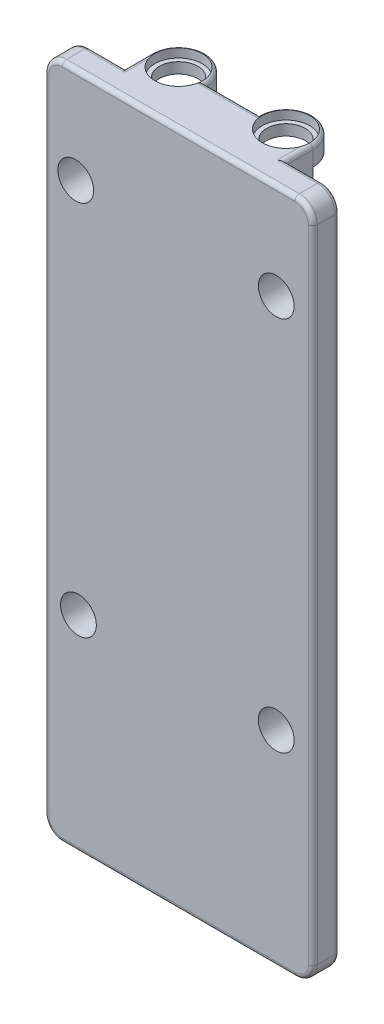
from build123d import *

# Parameters (mm, degrees)
BOSS_EXTRUDE1_OUTLINE_W        = 30
BOSS_EXTRUDE1_OUTLINE_H        = 75.6
BOSS_EXTRUDE1_DEPTH            = 3
BOSS_EXTRUDE1_START            = -0.5
BOSS_EXTRUDE1_2_DEPTH          = 0.5
BOSS_EXTRUDE1_START_2          = -51.669534626
BOSS_EXTRUDE1_3_OUTLINE_W      = 18
BOSS_EXTRUDE1_3_OUTLINE_H      = 2.5
BOSS_EXTRUDE1_3_DEPTH          = 12
BOSS_EXTRUDE1_START_3          = 5.930465374
BOSS_EXTRUDE1_4_OUTLINE_W      = 18
BOSS_EXTRUDE1_4_OUTLINE_H      = 2.5
BOSS_EXTRUDE1_4_DEPTH          = 12
BOSS_EXTRUDE1_START_4          = -54.669534626
BOSS_EXTRUDE1_5_DEPTH          = 18
BOSS_EXTRUDE1_START_5          = 2.930465374
BOSS_EXTRUDE1_6_DEPTH          = 18
BOSS_EXTRUDE1_START_6          = -53.669534626
BOSS_EXTRUDE1_7_OUTLINE_R      = 2
BOSS_EXTRUDE1_7_DEPTH          = 1.2
BOSS_EXTRUDE1_START_7          = -38.869534626
BOSS_EXTRUDE1_8_OUTLINE_R      = 2
BOSS_EXTRUDE1_8_DEPTH          = 1.2
BOSS_EXTRUDE1_START_8          = 3.930465374
BOSS_EXTRUDE1_9_OUTLINE_R      = 2
BOSS_EXTRUDE1_9_DEPTH          = 1.2
BOSS_EXTRUDE1_START_9          = 18.730465374
BOSS_EXTRUDE1_10_OUTLINE_R     = 2
BOSS_EXTRUDE1_10_DEPTH         = 1.2
BOSS_EXTRUDE1_11_DEPTH         = 1
BOSS_EXTRUDE1_START_10         = -37.669534626
BOSS_EXTRUDE1_12_DEPTH         = 1
BOSS_EXTRUDE1_13_DEPTH         = 1
BOSS_EXTRUDE1_START_11         = 19.930465374
BOSS_EXTRUDE1_14_DEPTH         = 1
SKETCH2_R                      = 2
CUT_EXTRUDE1_DEPTH             = 59.811945383
CUT_EXTRUDE2_DEPTH             = 59.428117544
FILLET1_R                      = 2
FILLET2_R                      = 0.5
SKETCH4_R                      = 2.15
CUT_EXTRUDE3_DEPTH             = 81.849261107
SKETCH5_R                      = 2.65
CUT_EXTRUDE4_DEPTH             = 1
SKETCH6_R                      = 2.65
CUT_EXTRUDE5_DEPTH             = 13.6
CUT_EXTRUDE6_REACH             = 67.492
SKETCH7_R                      = 2.65
CUT_EXTRUDE6_DIRECTION_2_REACH = 67.492
SKETCH8_R                      = 2.65
CUT_EXTRUDE7_DEPTH             = 13.6
CUT_EXTRUDE8_START             = -1
SKETCH9_R                      = 2.65
CUT_EXTRUDE8_DEPTH             = 1


with BuildPart() as part:
    # Boss-Extrude1: read off the stored shape, not the designer's step
    # Boss-Extrude1 outline → Boss-Extrude1 (new body)
    with BuildSketch(Plane.XY.offset(21.132055411)):
        with Locations((-4.725285891, -16.869534626)):
            Rectangle(BOSS_EXTRUDE1_OUTLINE_W, BOSS_EXTRUDE1_OUTLINE_H)
    extrude(amount=BOSS_EXTRUDE1_DEPTH)

    # Boss-Extrude1 2 outline → Boss-Extrude1 2 (add)
    with BuildSketch(Plane.XY.offset(21.132055411).offset(BOSS_EXTRUDE1_START)):
        Polygon((-13.725285891, 5.130465374), (-13.725285891, 2.930465374), (4.274714109, 2.930465374), (4.274714109, 5.130465374), (4.274714109, 18.730465374), (4.274714109, 20.930465374), (-13.725285891, 20.930465374), (-13.725285891, 18.730465374), align=None)
        Polygon((-13.725285891, -52.469534626), (-13.725285891, -54.669534626), (4.274714109, -54.669534626), (4.274714109, -52.469534626), (4.274714109, -38.869534626), (4.274714109, -36.669534626), (-13.725285891, -36.669534626), (-13.725285891, -38.869534626), align=None)
    extrude(amount=BOSS_EXTRUDE1_2_DEPTH)

    # Boss-Extrude1 3 outline → Boss-Extrude1 3 (add)
    with BuildSketch(Plane(origin=(0, 0, 0), x_dir=(1, 0, 0), z_dir=(0, 1, 0)).offset(BOSS_EXTRUDE1_START_2)):
        with Locations((-4.725285891, -19.382055411)):
            Rectangle(BOSS_EXTRUDE1_3_OUTLINE_W, BOSS_EXTRUDE1_3_OUTLINE_H)
    extrude(amount=BOSS_EXTRUDE1_3_DEPTH)

    # Boss-Extrude1 4 outline → Boss-Extrude1 4 (add)
    with BuildSketch(Plane(origin=(0, 0, 0), x_dir=(1, 0, 0), z_dir=(0, 1, 0)).offset(BOSS_EXTRUDE1_START_3)):
        with Locations((-4.725285891, -19.382055411)):
            Rectangle(BOSS_EXTRUDE1_4_OUTLINE_W, BOSS_EXTRUDE1_4_OUTLINE_H)
    extrude(amount=BOSS_EXTRUDE1_4_DEPTH)

    # Boss-Extrude1 5 outline → Boss-Extrude1 5 (add)
    with BuildSketch(Plane(origin=(0, 0, 0), x_dir=(1, 0, 0), z_dir=(0, 1, 0)).offset(BOSS_EXTRUDE1_START_4)):
        with BuildLine():
            Line((-1.225285891, -18.132055411), (-8.225285891, -18.132055411))
            ThreePointArc((-8.225285891, -18.132055411), (-8.957518938, -19.899822364), (-10.725285891, -20.632055411))
            Line((-10.725285891, -20.632055411), (1.274714109, -20.632055411))
            ThreePointArc((1.274714109, -20.632055411), (-0.493052844, -19.899822364), (-1.225285891, -18.132055411))
        make_face()
        with BuildLine():
            ThreePointArc((-10.725285891, -20.632055411), (-12.493052844, -19.899822364), (-13.225285891, -18.132055411))
            Line((-13.225285891, -18.132055411), (-13.725285891, -18.132055411))
            Line((-13.725285891, -18.132055411), (-13.725285891, -20.632055411))
            Line((-13.725285891, -20.632055411), (-10.725285891, -20.632055411))
        make_face()
        with BuildLine():
            ThreePointArc((3.774714109, -18.132055411), (3.042481062, -19.899822364), (1.274714109, -20.632055411))
            Line((1.274714109, -20.632055411), (4.274714109, -20.632055411))
            Line((4.274714109, -20.632055411), (4.274714109, -18.132055411))
            Line((4.274714109, -18.132055411), (3.774714109, -18.132055411))
        make_face()
    extrude(amount=BOSS_EXTRUDE1_5_DEPTH)

    # Boss-Extrude1 6 outline → Boss-Extrude1 6 (add)
    with BuildSketch(Plane(origin=(0, 0, 0), x_dir=(1, 0, 0), z_dir=(0, 1, 0)).offset(BOSS_EXTRUDE1_START_5)):
        with BuildLine():
            Line((-1.225285891, -18.132055411), (-8.225285891, -18.132055411))
            ThreePointArc((-8.225285891, -18.132055411), (-8.957518938, -19.899822364), (-10.725285891, -20.632055411))
            Line((-10.725285891, -20.632055411), (1.274714109, -20.632055411))
            ThreePointArc((1.274714109, -20.632055411), (-0.493052844, -19.899822364), (-1.225285891, -18.132055411))
        make_face()
        with BuildLine():
            ThreePointArc((-10.725285891, -20.632055411), (-12.493052844, -19.899822364), (-13.225285891, -18.132055411))
            Line((-13.225285891, -18.132055411), (-13.725285891, -18.132055411))
            Line((-13.725285891, -18.132055411), (-13.725285891, -20.632055411))
            Line((-13.725285891, -20.632055411), (-10.725285891, -20.632055411))
        make_face()
        with BuildLine():
            ThreePointArc((3.774714109, -18.132055411), (3.042481062, -19.899822364), (1.274714109, -20.632055411))
            Line((1.274714109, -20.632055411), (4.274714109, -20.632055411))
            Line((4.274714109, -20.632055411), (4.274714109, -18.132055411))
            Line((4.274714109, -18.132055411), (3.774714109, -18.132055411))
        make_face()
    extrude(amount=BOSS_EXTRUDE1_6_DEPTH)

    # Boss-Extrude1 7 outline → Boss-Extrude1 7 (add)
    # profile 1 of 2: a face of its own
    with BuildSketch(Plane(origin=(0, 0, 0), x_dir=(1, 0, 0), z_dir=(0, 1, 0)).offset(BOSS_EXTRUDE1_START_6)):
        with BuildLine():
            Line((-8.225285891, -18.132055411), (-7.725285891, -18.132055411))
            ThreePointArc((-7.725285891, -18.132055411), (-10.725285891, -15.132055411), (-13.725285891, -18.132055411))
            Line((-13.725285891, -18.132055411), (-13.225285891, -18.132055411))
            ThreePointArc((-13.225285891, -18.132055411), (-10.725285891, -20.632055411), (-8.225285891, -18.132055411))
        make_face()
        with Locations((-10.725285891, -18.132055411)):
            Circle(BOSS_EXTRUDE1_7_OUTLINE_R, mode=Mode.SUBTRACT)
    # profile 2 of 2: a face of its own
    with BuildSketch(Plane(origin=(0, 0, 0), x_dir=(1, 0, 0), z_dir=(0, 1, 0)).offset(BOSS_EXTRUDE1_START_6)):
        with BuildLine():
            ThreePointArc((-1.225285891, -18.132055411), (1.274714109, -20.632055411), (3.774714109, -18.132055411))
            Line((3.774714109, -18.132055411), (4.274714109, -18.132055411))
            ThreePointArc((4.274714109, -18.132055411), (1.274714109, -15.132055411), (-1.725285891, -18.132055411))
            Line((-1.725285891, -18.132055411), (-1.225285891, -18.132055411))
        make_face()
        with Locations((1.274714109, -18.132055411)):
            Circle(BOSS_EXTRUDE1_7_OUTLINE_R, mode=Mode.SUBTRACT)
    extrude(amount=BOSS_EXTRUDE1_7_DEPTH)

    # Boss-Extrude1 8 outline → Boss-Extrude1 8 (add)
    # profile 1 of 2: a face of its own
    with BuildSketch(Plane(origin=(0, 0, 0), x_dir=(1, 0, 0), z_dir=(0, 1, 0)).offset(BOSS_EXTRUDE1_START_7)):
        with BuildLine():
            Line((-8.225285891, -18.132055411), (-7.725285891, -18.132055411))
            ThreePointArc((-7.725285891, -18.132055411), (-10.725285891, -15.132055411), (-13.725285891, -18.132055411))
            Line((-13.725285891, -18.132055411), (-13.225285891, -18.132055411))
            ThreePointArc((-13.225285891, -18.132055411), (-10.725285891, -20.632055411), (-8.225285891, -18.132055411))
        make_face()
        with Locations((-10.725285891, -18.132055411)):
            Circle(BOSS_EXTRUDE1_8_OUTLINE_R, mode=Mode.SUBTRACT)
    # profile 2 of 2: a face of its own
    with BuildSketch(Plane(origin=(0, 0, 0), x_dir=(1, 0, 0), z_dir=(0, 1, 0)).offset(BOSS_EXTRUDE1_START_7)):
        with BuildLine():
            ThreePointArc((-1.225285891, -18.132055411), (1.274714109, -20.632055411), (3.774714109, -18.132055411))
            Line((3.774714109, -18.132055411), (4.274714109, -18.132055411))
            ThreePointArc((4.274714109, -18.132055411), (1.274714109, -15.132055411), (-1.725285891, -18.132055411))
            Line((-1.725285891, -18.132055411), (-1.225285891, -18.132055411))
        make_face()
        with Locations((1.274714109, -18.132055411)):
            Circle(BOSS_EXTRUDE1_8_OUTLINE_R, mode=Mode.SUBTRACT)
    extrude(amount=BOSS_EXTRUDE1_8_DEPTH)

    # Boss-Extrude1 9 outline → Boss-Extrude1 9 (add)
    # profile 1 of 2: a face of its own
    with BuildSketch(Plane(origin=(0, 0, 0), x_dir=(1, 0, 0), z_dir=(0, 1, 0)).offset(BOSS_EXTRUDE1_START_8)):
        with BuildLine():
            Line((-8.225285891, -18.132055411), (-7.725285891, -18.132055411))
            ThreePointArc((-7.725285891, -18.132055411), (-10.725285891, -15.132055411), (-13.725285891, -18.132055411))
            Line((-13.725285891, -18.132055411), (-13.225285891, -18.132055411))
            ThreePointArc((-13.225285891, -18.132055411), (-10.725285891, -20.632055411), (-8.225285891, -18.132055411))
        make_face()
        with Locations((-10.725285891, -18.132055411)):
            Circle(BOSS_EXTRUDE1_9_OUTLINE_R, mode=Mode.SUBTRACT)
    # profile 2 of 2: a face of its own
    with BuildSketch(Plane(origin=(0, 0, 0), x_dir=(1, 0, 0), z_dir=(0, 1, 0)).offset(BOSS_EXTRUDE1_START_8)):
        with BuildLine():
            ThreePointArc((-1.225285891, -18.132055411), (1.274714109, -20.632055411), (3.774714109, -18.132055411))
            Line((3.774714109, -18.132055411), (4.274714109, -18.132055411))
            ThreePointArc((4.274714109, -18.132055411), (1.274714109, -15.132055411), (-1.725285891, -18.132055411))
            Line((-1.725285891, -18.132055411), (-1.225285891, -18.132055411))
        make_face()
        with Locations((1.274714109, -18.132055411)):
            Circle(BOSS_EXTRUDE1_9_OUTLINE_R, mode=Mode.SUBTRACT)
    extrude(amount=BOSS_EXTRUDE1_9_DEPTH)

    # Boss-Extrude1 10 outline → Boss-Extrude1 10 (add)
    # profile 1 of 2: a face of its own
    with BuildSketch(Plane(origin=(0, 0, 0), x_dir=(1, 0, 0), z_dir=(0, 1, 0)).offset(BOSS_EXTRUDE1_START_9)):
        with BuildLine():
            Line((-8.225285891, -18.132055411), (-7.725285891, -18.132055411))
            ThreePointArc((-7.725285891, -18.132055411), (-10.725285891, -15.132055411), (-13.725285891, -18.132055411))
            Line((-13.725285891, -18.132055411), (-13.225285891, -18.132055411))
            ThreePointArc((-13.225285891, -18.132055411), (-10.725285891, -20.632055411), (-8.225285891, -18.132055411))
        make_face()
        with Locations((-10.725285891, -18.132055411)):
            Circle(BOSS_EXTRUDE1_10_OUTLINE_R, mode=Mode.SUBTRACT)
    # profile 2 of 2: a face of its own
    with BuildSketch(Plane(origin=(0, 0, 0), x_dir=(1, 0, 0), z_dir=(0, 1, 0)).offset(BOSS_EXTRUDE1_START_9)):
        with BuildLine():
            ThreePointArc((-1.225285891, -18.132055411), (1.274714109, -20.632055411), (3.774714109, -18.132055411))
            Line((3.774714109, -18.132055411), (4.274714109, -18.132055411))
            ThreePointArc((4.274714109, -18.132055411), (1.274714109, -15.132055411), (-1.725285891, -18.132055411))
            Line((-1.725285891, -18.132055411), (-1.225285891, -18.132055411))
        make_face()
        with Locations((1.274714109, -18.132055411)):
            Circle(BOSS_EXTRUDE1_10_OUTLINE_R, mode=Mode.SUBTRACT)
    extrude(amount=BOSS_EXTRUDE1_10_DEPTH)

    # Boss-Extrude1 11 outline → Boss-Extrude1 11 (add)
    with BuildSketch(Plane(origin=(0, 0, 0), x_dir=(1, 0, 0), z_dir=(0, 1, 0)).offset(BOSS_EXTRUDE1_START_4)):
        with BuildLine():
            ThreePointArc((-13.225285891, -18.132055411), (-10.725285891, -15.632055411), (-8.225285891, -18.132055411))
            Line((-8.225285891, -18.132055411), (-7.725285891, -18.132055411))
            ThreePointArc((-7.725285891, -18.132055411), (-10.725285891, -15.132055411), (-13.725285891, -18.132055411))
            Line((-13.725285891, -18.132055411), (-13.225285891, -18.132055411))
        make_face()
        with BuildLine():
            ThreePointArc((4.274714109, -18.132055411), (1.274714109, -15.132055411), (-1.725285891, -18.132055411))
            Line((-1.725285891, -18.132055411), (-1.225285891, -18.132055411))
            ThreePointArc((-1.225285891, -18.132055411), (1.274714109, -15.632055411), (3.774714109, -18.132055411))
            Line((3.774714109, -18.132055411), (4.274714109, -18.132055411))
        make_face()
    extrude(amount=BOSS_EXTRUDE1_11_DEPTH)

    # Boss-Extrude1 12 outline → Boss-Extrude1 12 (add)
    with BuildSketch(Plane(origin=(0, 0, 0), x_dir=(1, 0, 0), z_dir=(0, 1, 0)).offset(BOSS_EXTRUDE1_START_10)):
        with BuildLine():
            ThreePointArc((-13.225285891, -18.132055411), (-10.725285891, -15.632055411), (-8.225285891, -18.132055411))
            Line((-8.225285891, -18.132055411), (-7.725285891, -18.132055411))
            ThreePointArc((-7.725285891, -18.132055411), (-10.725285891, -15.132055411), (-13.725285891, -18.132055411))
            Line((-13.725285891, -18.132055411), (-13.225285891, -18.132055411))
        make_face()
        with BuildLine():
            ThreePointArc((4.274714109, -18.132055411), (1.274714109, -15.132055411), (-1.725285891, -18.132055411))
            Line((-1.725285891, -18.132055411), (-1.225285891, -18.132055411))
            ThreePointArc((-1.225285891, -18.132055411), (1.274714109, -15.632055411), (3.774714109, -18.132055411))
            Line((3.774714109, -18.132055411), (4.274714109, -18.132055411))
        make_face()
    extrude(amount=BOSS_EXTRUDE1_12_DEPTH)

    # Boss-Extrude1 13 outline → Boss-Extrude1 13 (add)
    with BuildSketch(Plane(origin=(0, 0, 0), x_dir=(1, 0, 0), z_dir=(0, 1, 0)).offset(BOSS_EXTRUDE1_START_5)):
        with BuildLine():
            ThreePointArc((-13.225285891, -18.132055411), (-10.725285891, -15.632055411), (-8.225285891, -18.132055411))
            Line((-8.225285891, -18.132055411), (-7.725285891, -18.132055411))
            ThreePointArc((-7.725285891, -18.132055411), (-10.725285891, -15.132055411), (-13.725285891, -18.132055411))
            Line((-13.725285891, -18.132055411), (-13.225285891, -18.132055411))
        make_face()
        with BuildLine():
            ThreePointArc((4.274714109, -18.132055411), (1.274714109, -15.132055411), (-1.725285891, -18.132055411))
            Line((-1.725285891, -18.132055411), (-1.225285891, -18.132055411))
            ThreePointArc((-1.225285891, -18.132055411), (1.274714109, -15.632055411), (3.774714109, -18.132055411))
            Line((3.774714109, -18.132055411), (4.274714109, -18.132055411))
        make_face()
    extrude(amount=BOSS_EXTRUDE1_13_DEPTH)

    # Boss-Extrude1 14 outline → Boss-Extrude1 14 (add)
    with BuildSketch(Plane(origin=(0, 0, 0), x_dir=(1, 0, 0), z_dir=(0, 1, 0)).offset(BOSS_EXTRUDE1_START_11)):
        with BuildLine():
            ThreePointArc((-13.225285891, -18.132055411), (-10.725285891, -15.632055411), (-8.225285891, -18.132055411))
            Line((-8.225285891, -18.132055411), (-7.725285891, -18.132055411))
            ThreePointArc((-7.725285891, -18.132055411), (-10.725285891, -15.132055411), (-13.725285891, -18.132055411))
            Line((-13.725285891, -18.132055411), (-13.225285891, -18.132055411))
        make_face()
        with BuildLine():
            ThreePointArc((4.274714109, -18.132055411), (1.274714109, -15.132055411), (-1.725285891, -18.132055411))
            Line((-1.725285891, -18.132055411), (-1.225285891, -18.132055411))
            ThreePointArc((-1.225285891, -18.132055411), (1.274714109, -15.632055411), (3.774714109, -18.132055411))
            Line((3.774714109, -18.132055411), (4.274714109, -18.132055411))
        make_face()
    extrude(amount=BOSS_EXTRUDE1_14_DEPTH)

    # Sketch2 → Cut-Extrude1 (cut, through all)
    with BuildSketch(Plane.XY.offset(24.132055411)):
        with Locations((-16.212785891, 10.230465374)):
            Circle(SKETCH2_R)
        with Locations((6.187214109, 10.230465374)):
            Circle(SKETCH2_R)
        with Locations((6.187214109, -31.769534626)):
            Circle(SKETCH2_R)
        with Locations((-15.912785891, -31.669534626)):
            Circle(SKETCH2_R)
    extrude(amount=-CUT_EXTRUDE1_DEPTH, mode=Mode.SUBTRACT)

    # Sketch3 → Cut-Extrude2 (cut, through all)
    with BuildSketch(Plane(origin=(0, 0, 21.132055411), x_dir=(-1, 0, 0), z_dir=(0, 0, -1))):
        Polygon((-6.13477618, 13.694170076), (-9.160651408, 12.007730303), (-9.213089336, 8.544025601), (-6.239652037, 6.766760672), (-3.21377681, 8.453200444), (-3.161338881, 11.916905147), align=None)
        Polygon((16.26522382, 13.694170076), (13.239348592, 12.007730303), (13.186910664, 8.544025601), (16.160347963, 6.766760672), (19.18622319, 8.453200444), (19.238661119, 11.916905147), align=None)
    extrude(amount=CUT_EXTRUDE2_DEPTH, mode=Mode.SUBTRACT)

    # Fillet1
    fillet1_edges = [part.edges().sort_by_distance(p)[0] for p in [
        (10.274714109, 20.930465374, 22.632055411),
        (-19.725285891, 20.930465374, 22.632055411),
        (10.274714109, -54.669534626, 22.632055411),
        (-19.725285891, -54.669534626, 22.632055411),
    ]]
    fillet(fillet1_edges, radius=FILLET1_R)

    # Fillet2
    fillet2_edges = [part.edges().sort_by_distance(p)[0] for p in [
        (4.274714109, 20.930465374, 19.632055411),
        (-10.725285891, 20.930465374, 15.132055411),
        (-13.725285891, -54.669534626, 19.632055411),
        (1.274714109, -54.669534626, 15.132055411),
        (-19.139499453, -54.083748188, 24.132055411),
        (-19.725285891, -16.869534626, 24.132055411),
        (-19.139499453, 20.344678936, 24.132055411),
        (-4.725285891, 20.930465374, 24.132055411),
        (9.688927671, 20.344678936, 24.132055411),
        (10.274714109, -16.869534626, 24.132055411),
        (9.688927671, -54.083748188, 24.132055411),
        (6.274714109, -54.669534626, 21.132055411),
        (9.688927671, -54.083748188, 21.132055411),
        (6.274714109, 20.930465374, 21.132055411),
        (9.688927671, 20.344678936, 21.132055411),
        (-15.725285891, 20.930465374, 21.132055411),
        (-19.139499453, 20.344678936, 21.132055411),
        (-15.725285891, -54.669534626, 21.132055411),
        (-19.139499453, -54.083748188, 21.132055411),
        (1.274714109, 20.930465374, 15.132055411),
        (-4.725285891, 20.930465374, 18.132055411),
        (-13.725285891, 20.930465374, 19.632055411),
        (-10.725285891, -54.669534626, 15.132055411),
        (-4.725285891, -54.669534626, 18.132055411),
        (4.274714109, -54.669534626, 19.632055411),
        (-4.725285891, -54.669534626, 24.132055411),
        (10.274714109, -16.869534626, 21.132055411),
        (-19.725285891, -16.869534626, 21.132055411),
        (4.274714109, -36.669534626, 19.632055411),
        (-10.725285891, -36.669534626, 15.132055411),
        (4.274714109, 2.930465374, 19.632055411),
        (-13.725285891, 2.930465374, 19.632055411),
        (1.274714109, -36.669534626, 15.132055411),
        (-4.725285891, -36.669534626, 18.132055411),
        (-13.725285891, -36.669534626, 19.632055411),
        (-4.725285891, 2.930465374, 18.132055411),
        (1.274714109, 2.930465374, 15.132055411),
        (-10.725285891, 2.930465374, 15.132055411),
    ]]
    fillet(fillet2_edges, radius=FILLET2_R - 0.0001)  # a hair under: the kernel refuses the full size

    # Sketch4 → Cut-Extrude3 (cut, through all)
    with BuildSketch(Plane.XZ.offset(53.669534626)):
        with Locations(Location((-10.725285891, 18.132055411, 0), (0, 0, 270))):
            Circle(SKETCH4_R)
        with Locations(Location((1.274714109, 18.132055411, 0), (0, 0, 270))):
            Circle(SKETCH4_R)
    extrude(amount=-CUT_EXTRUDE3_DEPTH, mode=Mode.SUBTRACT)

    # Sketch5 → Cut-Extrude4 (cut)
    with BuildSketch(Plane.XZ.offset(54.669534626)):
        with Locations(Location((-10.725285891, 18.132055411, 0), (0, 0, 180))):
            Circle(SKETCH5_R)
        with Locations((1.274714109, 18.132055411)):
            Circle(SKETCH5_R)
    extrude(amount=-CUT_EXTRUDE4_DEPTH, mode=Mode.SUBTRACT)

    # Sketch6 → Cut-Extrude5 (cut)
    with BuildSketch(Plane(origin=(0, -52.469534626, 0), x_dir=(1, 0, 0), z_dir=(0, 1, 0))):
        with Locations(Location((-10.725285891, -18.132055411, 0), (0, 0, 180))):
            Circle(SKETCH6_R)
        with Locations((1.274714109, -18.132055411)):
            Circle(SKETCH6_R)
    extrude(amount=CUT_EXTRUDE5_DEPTH, mode=Mode.SUBTRACT)

    # Cut-Extrude6: up to this face of the body (flat: up to its plane)
    cut_extrude6_end = Plane(part.part.faces().sort_by_distance((-9.007518938, -37.669534626, 19.849822364))[0])
    # Sketch7 → Cut-Extrude6 (cut, up to the picked face)
    with BuildSketch(Plane(origin=(0, -36.669534626, 0), x_dir=(1, 0, 0), z_dir=(0, 1, 0)), mode=Mode.PRIVATE) as cut_extrude6_sk1:
        with Locations(Location((-10.725285891, -18.132055411, 0), (0, 0, 180))):
            Circle(SKETCH7_R)
    cut_extrude6_tool1 = split(extrude(cut_extrude6_sk1.sketch, amount=-CUT_EXTRUDE6_REACH, mode=Mode.PRIVATE), bisect_by=cut_extrude6_end, keep=Keep.BOTH, mode=Mode.PRIVATE)
    # Sketch7 → Cut-Extrude6 (cut, up to the picked face)
    with BuildSketch(Plane(origin=(0, -36.669534626, 0), x_dir=(1, 0, 0), z_dir=(0, 1, 0)), mode=Mode.PRIVATE) as cut_extrude6_sk2:
        with Locations((1.274714109, -18.132055411)):
            Circle(SKETCH7_R)
    cut_extrude6_tool2 = split(extrude(cut_extrude6_sk2.sketch, amount=-CUT_EXTRUDE6_REACH, mode=Mode.PRIVATE), bisect_by=cut_extrude6_end, keep=Keep.BOTH, mode=Mode.PRIVATE)
    add(cut_extrude6_tool1.solids().sort_by(Axis((-10.725286, -36.669535, 18.132055), (0, -1, 0)))[0], mode=Mode.SUBTRACT)
    add(cut_extrude6_tool2.solids().sort_by(Axis((1.274714, -36.669535, 18.132055), (0, -1, 0)))[0], mode=Mode.SUBTRACT)

    # Cut-Extrude6 direction 2: up to this face of the body (flat: up to its plane)
    cut_extrude6_direction_2_end = Plane(part.part.faces().sort_by_distance((-9.007518938, 3.930465374, 19.849822364))[0])
    # Sketch7 → Cut-Extrude6 direction 2 (cut, up to the picked face)
    with BuildSketch(Plane(origin=(0, -36.669534626, 0), x_dir=(1, 0, 0), z_dir=(0, 1, 0)), mode=Mode.PRIVATE) as cut_extrude6_direction_2_sk1:
        with Locations(Location((-10.725285891, -18.132055411, 0), (0, 0, 180))):
            Circle(SKETCH7_R)
    cut_extrude6_direction_2_tool1 = split(extrude(cut_extrude6_direction_2_sk1.sketch, amount=CUT_EXTRUDE6_DIRECTION_2_REACH, mode=Mode.PRIVATE), bisect_by=cut_extrude6_direction_2_end, keep=Keep.BOTH, mode=Mode.PRIVATE)
    # Sketch7 → Cut-Extrude6 direction 2 (cut, up to the picked face)
    with BuildSketch(Plane(origin=(0, -36.669534626, 0), x_dir=(1, 0, 0), z_dir=(0, 1, 0)), mode=Mode.PRIVATE) as cut_extrude6_direction_2_sk2:
        with Locations((1.274714109, -18.132055411)):
            Circle(SKETCH7_R)
    cut_extrude6_direction_2_tool2 = split(extrude(cut_extrude6_direction_2_sk2.sketch, amount=CUT_EXTRUDE6_DIRECTION_2_REACH, mode=Mode.PRIVATE), bisect_by=cut_extrude6_direction_2_end, keep=Keep.BOTH, mode=Mode.PRIVATE)
    add(cut_extrude6_direction_2_tool1.solids().sort_by(Axis((-10.725286, -36.669535, 18.132055), (0, 1, 0)))[0], mode=Mode.SUBTRACT)
    add(cut_extrude6_direction_2_tool2.solids().sort_by(Axis((1.274714, -36.669535, 18.132055), (0, 1, 0)))[0], mode=Mode.SUBTRACT)

    # Sketch8 → Cut-Extrude7 (cut)
    with BuildSketch(Plane(origin=(0, 5.130465374, 0), x_dir=(1, 0, 0), z_dir=(0, 1, 0))):
        with Locations(Location((-10.725285891, -18.132055411, 0), (0, 0, 180))):
            Circle(SKETCH8_R)
        with Locations((1.274714109, -18.132055411)):
            Circle(SKETCH8_R)
    extrude(amount=CUT_EXTRUDE7_DEPTH, mode=Mode.SUBTRACT)

    # Sketch9 → Cut-Extrude8 (cut)
    with BuildSketch(Plane(origin=(0, 20.930465374, 0), x_dir=(1, 0, 0), z_dir=(0, 1, 0)).offset(CUT_EXTRUDE8_START)):
        with Locations(Location((-10.725285891, -18.132055411, 0), (0, 0, 180))):
            Circle(SKETCH9_R)
        with Locations((1.274714109, -18.132055411)):
            Circle(SKETCH9_R)
    extrude(amount=CUT_EXTRUDE8_DEPTH, mode=Mode.SUBTRACT)


solid = part.part
